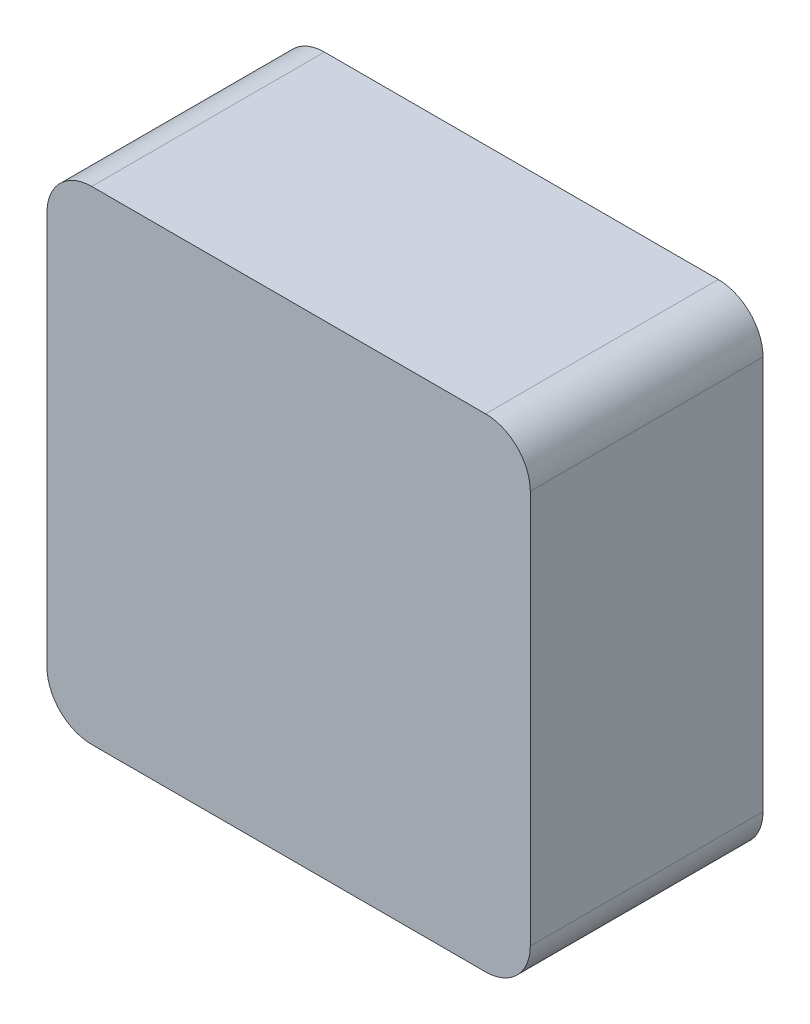
from build123d import *

# Parameters (mm, degrees)
CROQUIS1_W              = 54
CROQUIS1_H              = 54
SALIENTE_EXTRUIR1_DEPTH = 26
REDONDEO1_R             = 5


with BuildPart() as part:
    # Croquis1 → Saliente-Extruir1 (new body)
    with BuildSketch(Plane.XY):
        Rectangle(CROQUIS1_W, CROQUIS1_H)
    extrude(amount=SALIENTE_EXTRUIR1_DEPTH)

    # Redondeo1
    redondeo1_edges = [part.edges().sort_by_distance(p)[0] for p in [
        (-27, -27, 13),
        (27, -27, 13),
        (27, 27, 13),
        (-27, 27, 13),
    ]]
    fillet(redondeo1_edges, radius=REDONDEO1_R)


solid = part.part
